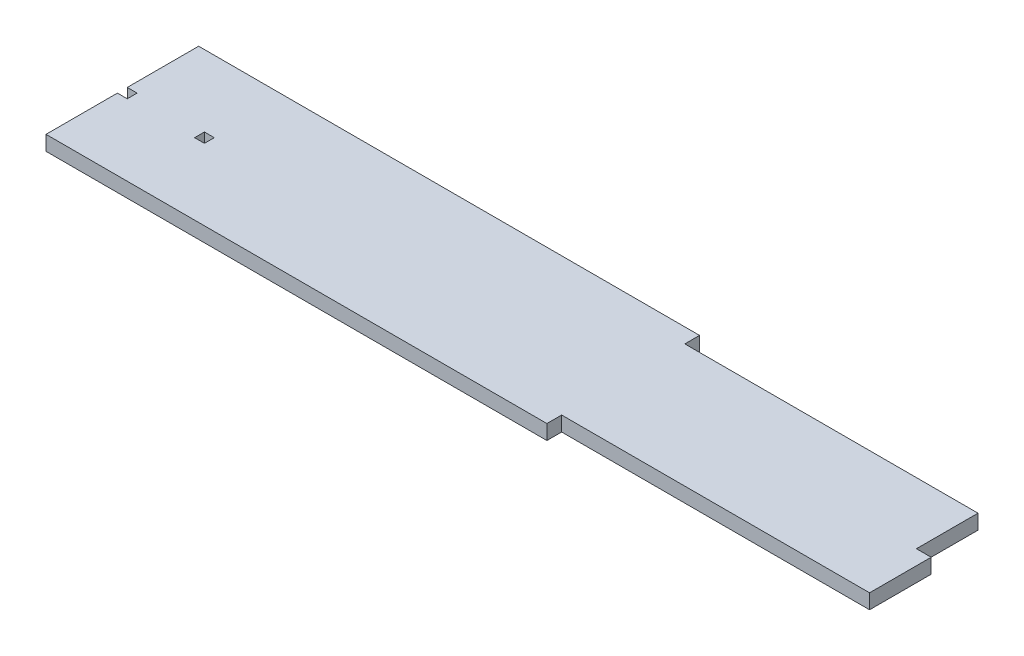
from build123d import *

# Parameters (mm, degrees)
SKETCH1_W           = 3.048
SKETCH1_H           = 3.048
BOSS_EXTRUDE1_DEPTH = 4.5593
CAVITY1_START       = 29.845
CAVITY1_OUTLINE_W   = 4.5593
CAVITY1_OUTLINE_H   = 4.5593
CAVITY1_DEPTH       = 95.25
CAVITY1_START_2     = 120.5357
CAVITY1_2_OUTLINE_W = 4.5593
CAVITY1_2_OUTLINE_H = 19.05
CAVITY1_2_DEPTH     = 4.5593


# Read off the part's stored shape, not the designer's step: Cavity1
with BuildPart() as part:
    # Sketch1 → Boss-Extrude1 (new body)
    with BuildSketch(Plane(origin=(0, 0, 0), x_dir=(1, 0, 0), z_dir=(0, 1, 0))):
        Polygon((125.095, -23.6093), (-125.095, -23.6093), (-125.095, -1.524), (-122.047, -1.524), (-122.047, 1.524), (-125.095, 1.524), (-125.095, 23.6093), (125.095, 23.6093), align=None)
        with Locations((-99.695, 0)):
            Rectangle(SKETCH1_W, SKETCH1_H, mode=Mode.SUBTRACT)
    extrude(amount=BOSS_EXTRUDE1_DEPTH)

    # Cavity1 outline → Cavity1 (cut)
    with BuildSketch(Plane.YZ.offset(CAVITY1_START)):
        with Locations((2.27965, 21.32965)):
            Rectangle(CAVITY1_OUTLINE_W, CAVITY1_OUTLINE_H)
        with Locations((2.27965, -21.32965)):
            Rectangle(CAVITY1_OUTLINE_W, CAVITY1_OUTLINE_H)
    extrude(amount=CAVITY1_DEPTH, mode=Mode.SUBTRACT)

    # Cavity1 2 outline → Cavity1 2 (cut)
    with BuildSketch(Plane.YZ.offset(CAVITY1_START_2)):
        with Locations((2.27965, -9.525)):
            Rectangle(CAVITY1_2_OUTLINE_W, CAVITY1_2_OUTLINE_H)
    extrude(amount=CAVITY1_2_DEPTH, mode=Mode.SUBTRACT)


solid = part.part
